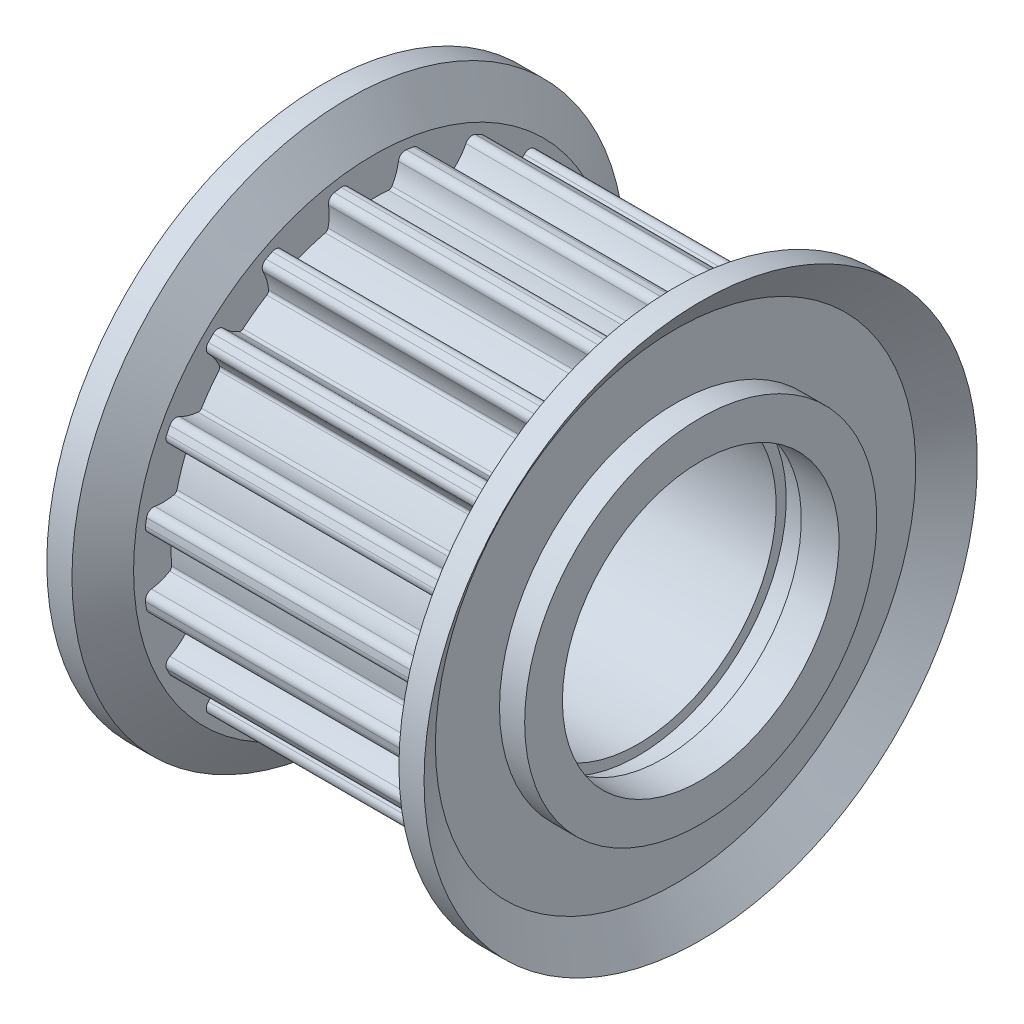
from build123d import *

# Parameters (mm, degrees)
CUT_EXTRUDE1_DEPTH  = 11
CUT_EXTRUDE2_DEPTH  = 11
CUT_EXTRUDE3_DEPTH  = 11
CUT_EXTRUDE4_DEPTH  = 11
CUT_EXTRUDE5_DEPTH  = 11
CUT_EXTRUDE6_DEPTH  = 11
CUT_EXTRUDE7_DEPTH  = 11
CUT_EXTRUDE8_DEPTH  = 11
CUT_EXTRUDE9_DEPTH  = 11
CUT_EXTRUDE10_DEPTH = 11
CUT_EXTRUDE11_DEPTH = 11
CUT_EXTRUDE12_DEPTH = 11
CUT_EXTRUDE13_DEPTH = 11
CUT_EXTRUDE14_DEPTH = 11
CUT_EXTRUDE15_DEPTH = 11
CUT_EXTRUDE16_DEPTH = 11
CUT_EXTRUDE17_DEPTH = 11
CUT_EXTRUDE18_DEPTH = 11
CUT_EXTRUDE19_DEPTH = 11
CUT_EXTRUDE20_DEPTH = 11
SKETCH23_R          = 5
CUT_EXTRUDE21_DEPTH = 22.610182785
SKETCH24_R          = 0.75
CUT_EXTRUDE22_DEPTH = 18.269916039


with BuildPart() as part:
    # Sketch1 → Revolve1 (revolve)
    with BuildSketch(Plane.XY):
        Polygon((-7.5, 4.5), (-5, 4.5), (-5, 5.5), (5, 5.5), (5, 5.9), (6, 5.9), (6, 5.5), (7.5, 5.5), (7.5, 7), (6.5, 7), (6.5, 9.55), (7.5, 11), (6.5, 11), (5.5, 9.55), (5.5, 9.17), (-5.5, 9.17), (-5.5, 9.55), (-6.5, 11), (-7.5, 11), (-6.5, 9.55), (-6.5, 7), (-7.5, 7), align=None)
    revolve(axis=Axis((20, 0, 0), (-1, 0, 0)))

    # Sketch2 → Cut-Extrude1 (cut)
    with BuildSketch(Plane(origin=(5.5, 0, 0), x_dir=(0, 0, -1), z_dir=(1, 0, 0))):
        with BuildLine():
            Line((1.297156606, 9.077790741), (1.297156606, 9.846928899))
            ThreePointArc((1.297156606, 9.846928899), (0, 9.932), (-1.297156606, 9.846928899))
            Line((-1.297156606, 9.846928899), (-1.297156606, 9.077790741))
            ThreePointArc((-1.297156606, 9.077790741), (-1.089477901, 9.024553121), (-0.980336508, 8.840018991))
            ThreePointArc((-0.980336508, 8.840018991), (-0.888349543, 8.463379284), (-0.724554349, 8.111967552))
            ThreePointArc((-0.724554349, 8.111967552), (-0.664988681, 8.055456464), (-0.584594729, 8.03877161))
            ThreePointArc((-0.584594729, 8.03877161), (7.9e-08, 8.06), (0.584594886, 8.038771599))
            ThreePointArc((0.584594886, 8.038771599), (0.664988748, 8.055456499), (0.724554346, 8.111967546))
            ThreePointArc((0.724554346, 8.111967546), (0.888349546, 8.463379292), (0.980336511, 8.840019016))
            ThreePointArc((0.980336511, 8.840019016), (1.089477911, 9.024553128), (1.297156606, 9.077790741))
        make_face()
    extrude(amount=-CUT_EXTRUDE1_DEPTH, mode=Mode.SUBTRACT)

    # Sketch3 → Cut-Extrude2 (cut)
    with BuildSketch(Plane(origin=(5.5, 0, 0), x_dir=(0, 0, -1), z_dir=(1, 0, 0))):
        with BuildLine():
            Line((4.038860853, 8.232648602), (4.276537615, 8.964142459))
            ThreePointArc((4.276537615, 8.964142459), (3.069156788, 9.44589332), (1.809199129, 9.76582933))
            Line((1.809199129, 9.76582933), (1.571522367, 9.034335474))
            ThreePointArc((1.571522367, 9.034335474), (1.752585224, 8.919527239), (1.799360675, 8.710298307))
            ThreePointArc((1.799360675, 8.710298307), (1.770457407, 8.323667124), (1.817643696, 7.938839208))
            ThreePointArc((1.817643696, 7.938839208), (1.856831127, 7.866687166), (1.928134415, 7.825975829))
            ThreePointArc((1.928134415, 7.825975829), (2.49067705, 7.665515497), (3.040099814, 7.464676358))
            ThreePointArc((3.040099814, 7.464676358), (3.121714837, 7.455701571), (3.195827961, 7.491039989))
            ThreePointArc((3.195827961, 7.491039989), (3.460198655, 7.774636919), (3.664071533, 8.104417047))
            ThreePointArc((3.664071533, 8.104417047), (3.82489535, 8.24619287), (4.038860853, 8.232648602))
        make_face()
    extrude(amount=-CUT_EXTRUDE2_DEPTH, mode=Mode.SUBTRACT)

    # Sketch4 → Cut-Extrude3 (cut)
    with BuildSketch(Plane(origin=(5.5, 0, 0), x_dir=(0, 0, -1), z_dir=(1, 0, 0))):
        with BuildLine():
            Line((6.38521326, 6.581637458), (6.837301326, 7.203883298))
            ThreePointArc((6.837301326, 7.203883298), (5.837883126, 8.035156788), (4.738457848, 8.728782345))
            Line((4.738457848, 8.728782345), (4.286369782, 8.106536504))
            ThreePointArc((4.286369782, 8.106536504), (4.423093096, 7.941395885), (4.402923898, 7.727952936))
            ThreePointArc((4.402923898, 7.727952936), (4.255959651, 7.369176431), (4.181918112, 6.988601969))
            ThreePointArc((4.181918112, 6.988601969), (4.196891366, 6.907871717), (4.252124329, 6.847119007))
            ThreePointArc((4.252124329, 6.847119007), (4.737549197, 6.520676928), (5.19801859, 6.159886585))
            ThreePointArc((5.19801859, 6.159886585), (5.272865729, 6.126130627), (5.35427167, 6.136837244))
            ThreePointArc((5.35427167, 6.136837244), (5.693339412, 6.324858916), (5.989141705, 6.575498271))
            ThreePointArc((5.989141705, 6.575498271), (6.185905382, 6.660637799), (6.38521326, 6.581637458))
        make_face()
    extrude(amount=-CUT_EXTRUDE3_DEPTH, mode=Mode.SUBTRACT)

    # Sketch5 → Cut-Extrude4 (cut)
    with BuildSketch(Plane(origin=(5.5, 0, 0), x_dir=(0, 0, -1), z_dir=(1, 0, 0))):
        with BuildLine():
            Line((8.106536504, 4.286369782), (8.728782345, 4.738457848))
            ThreePointArc((8.728782345, 4.738457848), (8.035156788, 5.837883126), (7.203883298, 6.837301326))
            Line((7.203883298, 6.837301326), (6.581637458, 6.38521326))
            ThreePointArc((6.581637458, 6.38521326), (6.660637799, 6.18590537), (6.575498253, 5.989141688))
            ThreePointArc((6.575498253, 5.989141688), (6.324858911, 5.693339405), (6.136837247, 5.354271676))
            ThreePointArc((6.136837247, 5.354271676), (6.126130638, 5.272865654), (6.159886687, 5.198018469))
            ThreePointArc((6.159886687, 5.198018469), (6.520677021, 4.73754907), (6.84711909, 4.252124195))
            ThreePointArc((6.84711909, 4.252124195), (6.907871784, 4.196891333), (6.988601962, 4.181918112))
            ThreePointArc((6.988601962, 4.181918112), (7.369176439, 4.255959653), (7.727952958, 4.40292391))
            ThreePointArc((7.727952958, 4.40292391), (7.941395896, 4.423093092), (8.106536504, 4.286369782))
        make_face()
    extrude(amount=-CUT_EXTRUDE4_DEPTH, mode=Mode.SUBTRACT)

    # Sketch6 → Cut-Extrude5 (cut)
    with BuildSketch(Plane(origin=(5.5, 0, 0), x_dir=(0, 0, -1), z_dir=(1, 0, 0))):
        with BuildLine():
            Line((9.034335474, 1.571522367), (9.76582933, 1.809199129))
            ThreePointArc((9.76582933, 1.809199129), (9.44589332, 3.069156788), (8.964142459, 4.276537615))
            Line((8.964142459, 4.276537615), (8.232648602, 4.038860853))
            ThreePointArc((8.232648602, 4.038860853), (8.246192866, 3.824895338), (8.104417025, 3.664071523))
            ThreePointArc((8.104417025, 3.664071523), (7.774636913, 3.46019865), (7.491039993, 3.195827967))
            ThreePointArc((7.491039993, 3.195827967), (7.455701559, 3.121714763), (7.464676417, 3.040099668))
            ThreePointArc((7.464676417, 3.040099668), (7.665515546, 2.4906769), (7.825975867, 1.928134262))
            ThreePointArc((7.825975867, 1.928134262), (7.866687219, 1.856831074), (7.938839201, 1.817643698))
            ThreePointArc((7.938839201, 1.817643698), (8.323667132, 1.770457407), (8.710298331, 1.79936068))
            ThreePointArc((8.710298331, 1.79936068), (8.919527249, 1.752585217), (9.034335474, 1.571522367))
        make_face()
    extrude(amount=-CUT_EXTRUDE5_DEPTH, mode=Mode.SUBTRACT)

    # Sketch7 → Cut-Extrude6 (cut)
    with BuildSketch(Plane(origin=(5.5, 0, 0), x_dir=(0, 0, -1), z_dir=(1, 0, 0))):
        with BuildLine():
            Line((9.077790741, -1.297156606), (9.846928899, -1.297156606))
            ThreePointArc((9.846928899, -1.297156606), (9.932, 0), (9.846928899, 1.297156606))
            Line((9.846928899, 1.297156606), (9.077790741, 1.297156606))
            ThreePointArc((9.077790741, 1.297156606), (9.024553121, 1.089477901), (8.840018991, 0.980336508))
            ThreePointArc((8.840018991, 0.980336508), (8.463379284, 0.888349543), (8.111967552, 0.724554349))
            ThreePointArc((8.111967552, 0.724554349), (8.055456464, 0.664988681), (8.03877161, 0.584594729))
            ThreePointArc((8.03877161, 0.584594729), (8.06, -7.9e-08), (8.038771599, -0.584594886))
            ThreePointArc((8.038771599, -0.584594886), (8.055456499, -0.664988748), (8.111967546, -0.724554346))
            ThreePointArc((8.111967546, -0.724554346), (8.463379292, -0.888349546), (8.840019016, -0.980336511))
            ThreePointArc((8.840019016, -0.980336511), (9.024553128, -1.089477911), (9.077790741, -1.297156606))
        make_face()
    extrude(amount=-CUT_EXTRUDE6_DEPTH, mode=Mode.SUBTRACT)

    # Sketch8 → Cut-Extrude7 (cut)
    with BuildSketch(Plane(origin=(5.5, 0, 0), x_dir=(0, 0, -1), z_dir=(1, 0, 0))):
        with BuildLine():
            Line((8.232648602, -4.038860853), (8.964142459, -4.276537615))
            ThreePointArc((8.964142459, -4.276537615), (9.44589332, -3.069156788), (9.76582933, -1.809199129))
            Line((9.76582933, -1.809199129), (9.034335474, -1.571522367))
            ThreePointArc((9.034335474, -1.571522367), (8.919527239, -1.752585224), (8.710298307, -1.799360675))
            ThreePointArc((8.710298307, -1.799360675), (8.323667124, -1.770457407), (7.938839208, -1.817643696))
            ThreePointArc((7.938839208, -1.817643696), (7.866687166, -1.856831127), (7.825975829, -1.928134415))
            ThreePointArc((7.825975829, -1.928134415), (7.665515497, -2.49067705), (7.464676358, -3.040099814))
            ThreePointArc((7.464676358, -3.040099814), (7.455701571, -3.121714837), (7.491039989, -3.195827961))
            ThreePointArc((7.491039989, -3.195827961), (7.774636919, -3.460198655), (8.104417047, -3.664071533))
            ThreePointArc((8.104417047, -3.664071533), (8.24619287, -3.82489535), (8.232648602, -4.038860853))
        make_face()
    extrude(amount=-CUT_EXTRUDE7_DEPTH, mode=Mode.SUBTRACT)

    # Sketch9 → Cut-Extrude8 (cut)
    with BuildSketch(Plane(origin=(5.5, 0, 0), x_dir=(0, 0, -1), z_dir=(1, 0, 0))):
        with BuildLine():
            Line((6.581637458, -6.38521326), (7.203883298, -6.837301326))
            ThreePointArc((7.203883298, -6.837301326), (8.035156788, -5.837883126), (8.728782345, -4.738457848))
            Line((8.728782345, -4.738457848), (8.106536504, -4.286369782))
            ThreePointArc((8.106536504, -4.286369782), (7.941395885, -4.423093096), (7.727952936, -4.402923898))
            ThreePointArc((7.727952936, -4.402923898), (7.369176431, -4.255959651), (6.988601969, -4.181918112))
            ThreePointArc((6.988601969, -4.181918112), (6.907871717, -4.196891366), (6.847119007, -4.252124329))
            ThreePointArc((6.847119007, -4.252124329), (6.520676928, -4.737549197), (6.159886585, -5.19801859))
            ThreePointArc((6.159886585, -5.19801859), (6.126130627, -5.272865729), (6.136837244, -5.35427167))
            ThreePointArc((6.136837244, -5.35427167), (6.324858916, -5.693339412), (6.575498271, -5.989141705))
            ThreePointArc((6.575498271, -5.989141705), (6.660637799, -6.185905382), (6.581637458, -6.38521326))
        make_face()
    extrude(amount=-CUT_EXTRUDE8_DEPTH, mode=Mode.SUBTRACT)

    # Sketch10 → Cut-Extrude9 (cut)
    with BuildSketch(Plane(origin=(5.5, 0, 0), x_dir=(0, 0, -1), z_dir=(1, 0, 0))):
        with BuildLine():
            Line((4.286369782, -8.106536504), (4.738457848, -8.728782345))
            ThreePointArc((4.738457848, -8.728782345), (5.837883126, -8.035156788), (6.837301326, -7.203883298))
            Line((6.837301326, -7.203883298), (6.38521326, -6.581637458))
            ThreePointArc((6.38521326, -6.581637458), (6.18590537, -6.660637799), (5.989141688, -6.575498253))
            ThreePointArc((5.989141688, -6.575498253), (5.693339405, -6.324858911), (5.354271676, -6.136837247))
            ThreePointArc((5.354271676, -6.136837247), (5.272865654, -6.126130638), (5.198018469, -6.159886687))
            ThreePointArc((5.198018469, -6.159886687), (4.73754907, -6.520677021), (4.252124195, -6.84711909))
            ThreePointArc((4.252124195, -6.84711909), (4.196891333, -6.907871784), (4.181918112, -6.988601962))
            ThreePointArc((4.181918112, -6.988601962), (4.255959653, -7.369176439), (4.40292391, -7.727952958))
            ThreePointArc((4.40292391, -7.727952958), (4.423093092, -7.941395896), (4.286369782, -8.106536504))
        make_face()
    extrude(amount=-CUT_EXTRUDE9_DEPTH, mode=Mode.SUBTRACT)

    # Sketch11 → Cut-Extrude10 (cut)
    with BuildSketch(Plane(origin=(5.5, 0, 0), x_dir=(0, 0, -1), z_dir=(1, 0, 0))):
        with BuildLine():
            Line((1.571522367, -9.034335474), (1.809199129, -9.76582933))
            ThreePointArc((1.809199129, -9.76582933), (3.069156788, -9.44589332), (4.276537615, -8.964142459))
            Line((4.276537615, -8.964142459), (4.038860853, -8.232648602))
            ThreePointArc((4.038860853, -8.232648602), (3.824895338, -8.246192866), (3.664071523, -8.104417025))
            ThreePointArc((3.664071523, -8.104417025), (3.46019865, -7.774636913), (3.195827967, -7.491039993))
            ThreePointArc((3.195827967, -7.491039993), (3.121714763, -7.455701559), (3.040099668, -7.464676417))
            ThreePointArc((3.040099668, -7.464676417), (2.4906769, -7.665515546), (1.928134262, -7.825975867))
            ThreePointArc((1.928134262, -7.825975867), (1.856831074, -7.866687219), (1.817643698, -7.938839201))
            ThreePointArc((1.817643698, -7.938839201), (1.770457407, -8.323667132), (1.79936068, -8.710298331))
            ThreePointArc((1.79936068, -8.710298331), (1.752585217, -8.919527249), (1.571522367, -9.034335474))
        make_face()
    extrude(amount=-CUT_EXTRUDE10_DEPTH, mode=Mode.SUBTRACT)

    # Sketch12 → Cut-Extrude11 (cut)
    with BuildSketch(Plane(origin=(5.5, 0, 0), x_dir=(0, 0, -1), z_dir=(1, 0, 0))):
        with BuildLine():
            Line((-1.297156606, -9.077790741), (-1.297156606, -9.846928899))
            ThreePointArc((-1.297156606, -9.846928899), (0, -9.932), (1.297156606, -9.846928899))
            Line((1.297156606, -9.846928899), (1.297156606, -9.077790741))
            ThreePointArc((1.297156606, -9.077790741), (1.089477901, -9.024553121), (0.980336508, -8.840018991))
            ThreePointArc((0.980336508, -8.840018991), (0.888349543, -8.463379284), (0.724554349, -8.111967552))
            ThreePointArc((0.724554349, -8.111967552), (0.664988681, -8.055456464), (0.584594729, -8.03877161))
            ThreePointArc((0.584594729, -8.03877161), (-7.9e-08, -8.06), (-0.584594886, -8.038771599))
            ThreePointArc((-0.584594886, -8.038771599), (-0.664988748, -8.055456499), (-0.724554346, -8.111967546))
            ThreePointArc((-0.724554346, -8.111967546), (-0.888349546, -8.463379292), (-0.980336511, -8.840019016))
            ThreePointArc((-0.980336511, -8.840019016), (-1.089477911, -9.024553128), (-1.297156606, -9.077790741))
        make_face()
    extrude(amount=-CUT_EXTRUDE11_DEPTH, mode=Mode.SUBTRACT)

    # Sketch13 → Cut-Extrude12 (cut)
    with BuildSketch(Plane(origin=(5.5, 0, 0), x_dir=(0, 0, -1), z_dir=(1, 0, 0))):
        with BuildLine():
            Line((-4.038860853, -8.232648602), (-4.276537615, -8.964142459))
            ThreePointArc((-4.276537615, -8.964142459), (-3.069156788, -9.44589332), (-1.809199129, -9.76582933))
            Line((-1.809199129, -9.76582933), (-1.571522367, -9.034335474))
            ThreePointArc((-1.571522367, -9.034335474), (-1.752585224, -8.919527239), (-1.799360675, -8.710298307))
            ThreePointArc((-1.799360675, -8.710298307), (-1.770457407, -8.323667124), (-1.817643696, -7.938839208))
            ThreePointArc((-1.817643696, -7.938839208), (-1.856831127, -7.866687166), (-1.928134415, -7.825975829))
            ThreePointArc((-1.928134415, -7.825975829), (-2.49067705, -7.665515497), (-3.040099814, -7.464676358))
            ThreePointArc((-3.040099814, -7.464676358), (-3.121714837, -7.455701571), (-3.195827961, -7.491039989))
            ThreePointArc((-3.195827961, -7.491039989), (-3.460198655, -7.774636919), (-3.664071533, -8.104417047))
            ThreePointArc((-3.664071533, -8.104417047), (-3.82489535, -8.24619287), (-4.038860853, -8.232648602))
        make_face()
    extrude(amount=-CUT_EXTRUDE12_DEPTH, mode=Mode.SUBTRACT)

    # Sketch14 → Cut-Extrude13 (cut)
    with BuildSketch(Plane(origin=(5.5, 0, 0), x_dir=(0, 0, -1), z_dir=(1, 0, 0))):
        with BuildLine():
            Line((-6.38521326, -6.581637458), (-6.837301326, -7.203883298))
            ThreePointArc((-6.837301326, -7.203883298), (-5.837883126, -8.035156788), (-4.738457848, -8.728782345))
            Line((-4.738457848, -8.728782345), (-4.286369782, -8.106536504))
            ThreePointArc((-4.286369782, -8.106536504), (-4.423093096, -7.941395885), (-4.402923898, -7.727952936))
            ThreePointArc((-4.402923898, -7.727952936), (-4.255959651, -7.369176431), (-4.181918112, -6.988601969))
            ThreePointArc((-4.181918112, -6.988601969), (-4.196891366, -6.907871717), (-4.252124329, -6.847119007))
            ThreePointArc((-4.252124329, -6.847119007), (-4.737549197, -6.520676928), (-5.19801859, -6.159886585))
            ThreePointArc((-5.19801859, -6.159886585), (-5.272865729, -6.126130627), (-5.35427167, -6.136837244))
            ThreePointArc((-5.35427167, -6.136837244), (-5.693339412, -6.324858916), (-5.989141705, -6.575498271))
            ThreePointArc((-5.989141705, -6.575498271), (-6.185905382, -6.660637799), (-6.38521326, -6.581637458))
        make_face()
    extrude(amount=-CUT_EXTRUDE13_DEPTH, mode=Mode.SUBTRACT)

    # Sketch15 → Cut-Extrude14 (cut)
    with BuildSketch(Plane(origin=(5.5, 0, 0), x_dir=(0, 0, -1), z_dir=(1, 0, 0))):
        with BuildLine():
            Line((-8.106536504, -4.286369782), (-8.728782345, -4.738457848))
            ThreePointArc((-8.728782345, -4.738457848), (-8.035156788, -5.837883126), (-7.203883298, -6.837301326))
            Line((-7.203883298, -6.837301326), (-6.581637458, -6.38521326))
            ThreePointArc((-6.581637458, -6.38521326), (-6.660637799, -6.18590537), (-6.575498253, -5.989141688))
            ThreePointArc((-6.575498253, -5.989141688), (-6.324858911, -5.693339405), (-6.136837247, -5.354271676))
            ThreePointArc((-6.136837247, -5.354271676), (-6.126130638, -5.272865654), (-6.159886687, -5.198018469))
            ThreePointArc((-6.159886687, -5.198018469), (-6.520677021, -4.73754907), (-6.84711909, -4.252124195))
            ThreePointArc((-6.84711909, -4.252124195), (-6.907871784, -4.196891333), (-6.988601962, -4.181918112))
            ThreePointArc((-6.988601962, -4.181918112), (-7.369176439, -4.255959653), (-7.727952958, -4.40292391))
            ThreePointArc((-7.727952958, -4.40292391), (-7.941395896, -4.423093092), (-8.106536504, -4.286369782))
        make_face()
    extrude(amount=-CUT_EXTRUDE14_DEPTH, mode=Mode.SUBTRACT)

    # Sketch16 → Cut-Extrude15 (cut)
    with BuildSketch(Plane(origin=(5.5, 0, 0), x_dir=(0, 0, -1), z_dir=(1, 0, 0))):
        with BuildLine():
            Line((-9.034335474, -1.571522367), (-9.76582933, -1.809199129))
            ThreePointArc((-9.76582933, -1.809199129), (-9.44589332, -3.069156788), (-8.964142459, -4.276537615))
            Line((-8.964142459, -4.276537615), (-8.232648602, -4.038860853))
            ThreePointArc((-8.232648602, -4.038860853), (-8.246192866, -3.824895338), (-8.104417025, -3.664071523))
            ThreePointArc((-8.104417025, -3.664071523), (-7.774636913, -3.46019865), (-7.491039993, -3.195827967))
            ThreePointArc((-7.491039993, -3.195827967), (-7.455701559, -3.121714763), (-7.464676417, -3.040099668))
            ThreePointArc((-7.464676417, -3.040099668), (-7.665515546, -2.4906769), (-7.825975867, -1.928134262))
            ThreePointArc((-7.825975867, -1.928134262), (-7.866687219, -1.856831074), (-7.938839201, -1.817643698))
            ThreePointArc((-7.938839201, -1.817643698), (-8.323667132, -1.770457407), (-8.710298331, -1.79936068))
            ThreePointArc((-8.710298331, -1.79936068), (-8.919527249, -1.752585217), (-9.034335474, -1.571522367))
        make_face()
    extrude(amount=-CUT_EXTRUDE15_DEPTH, mode=Mode.SUBTRACT)

    # Sketch17 → Cut-Extrude16 (cut)
    with BuildSketch(Plane(origin=(5.5, 0, 0), x_dir=(0, 0, -1), z_dir=(1, 0, 0))):
        with BuildLine():
            Line((-9.077790741, 1.297156606), (-9.846928899, 1.297156606))
            ThreePointArc((-9.846928899, 1.297156606), (-9.932, 0), (-9.846928899, -1.297156606))
            Line((-9.846928899, -1.297156606), (-9.077790741, -1.297156606))
            ThreePointArc((-9.077790741, -1.297156606), (-9.024553121, -1.089477901), (-8.840018991, -0.980336508))
            ThreePointArc((-8.840018991, -0.980336508), (-8.463379284, -0.888349543), (-8.111967552, -0.724554349))
            ThreePointArc((-8.111967552, -0.724554349), (-8.055456464, -0.664988681), (-8.03877161, -0.584594729))
            ThreePointArc((-8.03877161, -0.584594729), (-8.06, 7.9e-08), (-8.038771599, 0.584594886))
            ThreePointArc((-8.038771599, 0.584594886), (-8.055456499, 0.664988748), (-8.111967546, 0.724554346))
            ThreePointArc((-8.111967546, 0.724554346), (-8.463379292, 0.888349546), (-8.840019016, 0.980336511))
            ThreePointArc((-8.840019016, 0.980336511), (-9.024553128, 1.089477911), (-9.077790741, 1.297156606))
        make_face()
    extrude(amount=-CUT_EXTRUDE16_DEPTH, mode=Mode.SUBTRACT)

    # Sketch18 → Cut-Extrude17 (cut)
    with BuildSketch(Plane(origin=(5.5, 0, 0), x_dir=(0, 0, -1), z_dir=(1, 0, 0))):
        with BuildLine():
            Line((-8.232648602, 4.038860853), (-8.964142459, 4.276537615))
            ThreePointArc((-8.964142459, 4.276537615), (-9.44589332, 3.069156788), (-9.76582933, 1.809199129))
            Line((-9.76582933, 1.809199129), (-9.034335474, 1.571522367))
            ThreePointArc((-9.034335474, 1.571522367), (-8.919527239, 1.752585224), (-8.710298307, 1.799360675))
            ThreePointArc((-8.710298307, 1.799360675), (-8.323667124, 1.770457407), (-7.938839208, 1.817643696))
            ThreePointArc((-7.938839208, 1.817643696), (-7.866687166, 1.856831127), (-7.825975829, 1.928134415))
            ThreePointArc((-7.825975829, 1.928134415), (-7.665515497, 2.49067705), (-7.464676358, 3.040099814))
            ThreePointArc((-7.464676358, 3.040099814), (-7.455701571, 3.121714837), (-7.491039989, 3.195827961))
            ThreePointArc((-7.491039989, 3.195827961), (-7.774636919, 3.460198655), (-8.104417047, 3.664071533))
            ThreePointArc((-8.104417047, 3.664071533), (-8.24619287, 3.82489535), (-8.232648602, 4.038860853))
        make_face()
    extrude(amount=-CUT_EXTRUDE17_DEPTH, mode=Mode.SUBTRACT)

    # Sketch19 → Cut-Extrude18 (cut)
    with BuildSketch(Plane(origin=(5.5, 0, 0), x_dir=(0, 0, -1), z_dir=(1, 0, 0))):
        with BuildLine():
            Line((-6.581637458, 6.38521326), (-7.203883298, 6.837301326))
            ThreePointArc((-7.203883298, 6.837301326), (-8.035156788, 5.837883126), (-8.728782345, 4.738457848))
            Line((-8.728782345, 4.738457848), (-8.106536504, 4.286369782))
            ThreePointArc((-8.106536504, 4.286369782), (-7.941395885, 4.423093096), (-7.727952936, 4.402923898))
            ThreePointArc((-7.727952936, 4.402923898), (-7.369176431, 4.255959651), (-6.988601969, 4.181918112))
            ThreePointArc((-6.988601969, 4.181918112), (-6.907871717, 4.196891366), (-6.847119007, 4.252124329))
            ThreePointArc((-6.847119007, 4.252124329), (-6.520676928, 4.737549197), (-6.159886585, 5.19801859))
            ThreePointArc((-6.159886585, 5.19801859), (-6.126130627, 5.272865729), (-6.136837244, 5.35427167))
            ThreePointArc((-6.136837244, 5.35427167), (-6.324858916, 5.693339412), (-6.575498271, 5.989141705))
            ThreePointArc((-6.575498271, 5.989141705), (-6.660637799, 6.185905382), (-6.581637458, 6.38521326))
        make_face()
    extrude(amount=-CUT_EXTRUDE18_DEPTH, mode=Mode.SUBTRACT)

    # Sketch20 → Cut-Extrude19 (cut)
    with BuildSketch(Plane(origin=(5.5, 0, 0), x_dir=(0, 0, -1), z_dir=(1, 0, 0))):
        with BuildLine():
            Line((-4.286369782, 8.106536504), (-4.738457848, 8.728782345))
            ThreePointArc((-4.738457848, 8.728782345), (-5.837883126, 8.035156788), (-6.837301326, 7.203883298))
            Line((-6.837301326, 7.203883298), (-6.38521326, 6.581637458))
            ThreePointArc((-6.38521326, 6.581637458), (-6.18590537, 6.660637799), (-5.989141688, 6.575498253))
            ThreePointArc((-5.989141688, 6.575498253), (-5.693339405, 6.324858911), (-5.354271676, 6.136837247))
            ThreePointArc((-5.354271676, 6.136837247), (-5.272865654, 6.126130638), (-5.198018469, 6.159886687))
            ThreePointArc((-5.198018469, 6.159886687), (-4.73754907, 6.520677021), (-4.252124195, 6.84711909))
            ThreePointArc((-4.252124195, 6.84711909), (-4.196891333, 6.907871784), (-4.181918112, 6.988601962))
            ThreePointArc((-4.181918112, 6.988601962), (-4.255959653, 7.369176439), (-4.40292391, 7.727952958))
            ThreePointArc((-4.40292391, 7.727952958), (-4.423093092, 7.941395896), (-4.286369782, 8.106536504))
        make_face()
    extrude(amount=-CUT_EXTRUDE19_DEPTH, mode=Mode.SUBTRACT)

    # Sketch21 → Cut-Extrude20 (cut)
    with BuildSketch(Plane(origin=(5.5, 0, 0), x_dir=(0, 0, -1), z_dir=(1, 0, 0))):
        with BuildLine():
            Line((-1.571522367, 9.034335474), (-1.809199129, 9.76582933))
            ThreePointArc((-1.809199129, 9.76582933), (-3.069156788, 9.44589332), (-4.276537615, 8.964142459))
            Line((-4.276537615, 8.964142459), (-4.038860853, 8.232648602))
            ThreePointArc((-4.038860853, 8.232648602), (-3.824895338, 8.246192866), (-3.664071523, 8.104417025))
            ThreePointArc((-3.664071523, 8.104417025), (-3.46019865, 7.774636913), (-3.195827967, 7.491039993))
            ThreePointArc((-3.195827967, 7.491039993), (-3.121714763, 7.455701559), (-3.040099668, 7.464676417))
            ThreePointArc((-3.040099668, 7.464676417), (-2.4906769, 7.665515546), (-1.928134262, 7.825975867))
            ThreePointArc((-1.928134262, 7.825975867), (-1.856831074, 7.866687219), (-1.817643698, 7.938839201))
            ThreePointArc((-1.817643698, 7.938839201), (-1.770457407, 8.323667132), (-1.79936068, 8.710298331))
            ThreePointArc((-1.79936068, 8.710298331), (-1.752585217, 8.919527249), (-1.571522367, 9.034335474))
        make_face()
    extrude(amount=-CUT_EXTRUDE20_DEPTH, mode=Mode.SUBTRACT)

    # Sketch23 → Cut-Extrude21 (cut, through all)
    with BuildSketch(Plane.ZY.offset(7.5)):
        Circle(SKETCH23_R)
    extrude(amount=-CUT_EXTRUDE21_DEPTH, mode=Mode.SUBTRACT)

    # Sketch24 → Cut-Extrude22 (cut, through all)
    with BuildSketch(Plane(origin=(0, 0, 0), x_dir=(1, 0, 0), z_dir=(0, 1, 0))):
        Circle(SKETCH24_R)
    extrude(amount=-CUT_EXTRUDE22_DEPTH, mode=Mode.SUBTRACT)


solid = part.part
